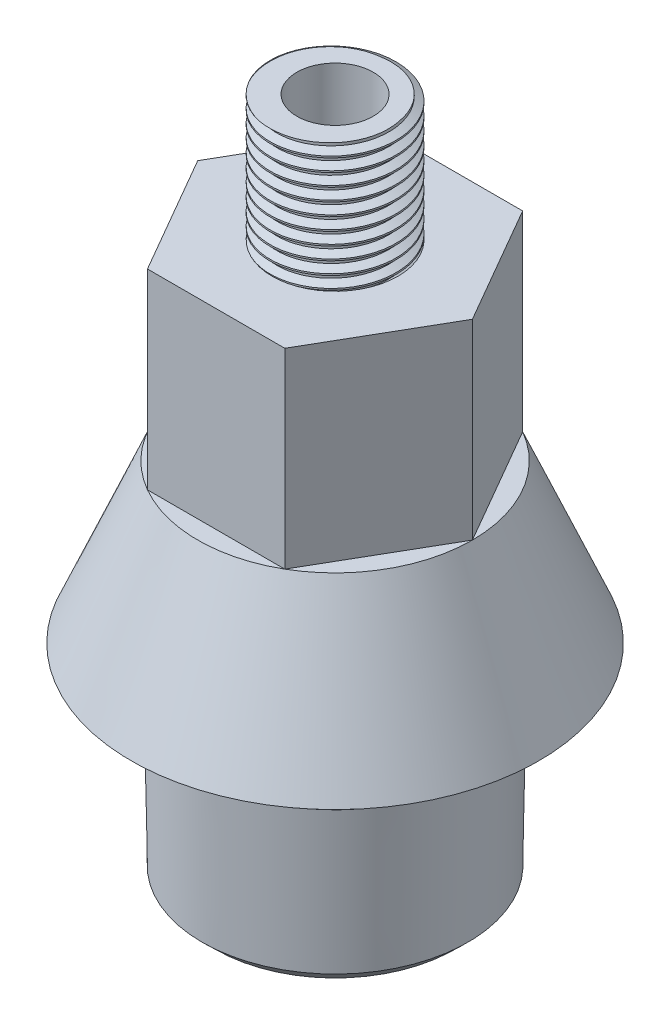
from build123d import *

# Parameters (mm, degrees)
BOSS_EXTRUDE1_DEPTH             = 19.0754
SKETCH2_R                       = 6.2738
BOSS_EXTRUDE2_DEPTH             = 12.5857
SKETCH3_R                       = 13.696826846
SKETCH4_R                       = 20.3327
SKETCH6_R                       = 13.5001
SKETCH8_R                       = 13.5001
BOSS_EXTRUDE3_DEPTH             = 15.6337
BOSS_EXTRUDE3_TAPER             = 1
CHAMFER1_SIZE                   = 1.27
CHAMFER1_SIZE_2                 = 1.292758643
THREAD1_PITCH                   = 1.27
CIRPATTERN1_COUNT               = 2
SKETCH13_R                      = 3.81
CUT_EXTRUDE1_DEPTH              = 47.3837
TAP_DRILL_FOR_5_8_11_TAP1_D     = 13.49248
TAP_DRILL_FOR_5_8_11_TAP1_DEPTH = 20.266950057
TAP_DRILL_FOR_5_8_11_TAP1_TIP   = 4.053549943


with BuildPart() as part:
    # Sketch1 → Boss-Extrude1 (new body)
    with BuildSketch(Plane(origin=(0, 0, 0), x_dir=(1, 0, 0), z_dir=(0, 1, 0))):
        Polygon((13.696826846, 0), (6.848413423, 11.8618), (-6.848413423, 11.8618), (-13.696826846, 0), (-6.848413423, -11.8618), (6.848413423, -11.8618), align=None)
    extrude(amount=BOSS_EXTRUDE1_DEPTH)

    # Sketch2 → Boss-Extrude2 (add)
    with BuildSketch(Plane(origin=(0, 19.0754, 0), x_dir=(1, 0, 0), z_dir=(0, 1, 0))):
        with Locations(Location((0, 0, 0), (0, 0, 270))):
            Circle(SKETCH2_R)
    extrude(amount=BOSS_EXTRUDE2_DEPTH)

    # Sketch3 → Loft1 section 0
    with BuildSketch(Plane.XZ):
        Circle(SKETCH3_R)
    # Sketch4 → Loft1 section 1
    with BuildSketch(Plane(origin=(0, -15.748, 0), x_dir=(-1, 0, 0), z_dir=(0, -1, 0))):
        Circle(SKETCH4_R)
    loft()

    # Sketch6 → section 0 of loft2
    with BuildSketch(Plane(origin=(0, -20.5994, 0), x_dir=(-1, 0, 0), z_dir=(0, -1, 0)), mode=Mode.PRIVATE) as loft2_s0:
        Circle(SKETCH6_R)
    # loft up to a face of the part (loft2)
    loft([loft2_s0.sketch, part.faces().sort_by_distance((0, -15.748, 0))[0]])

    # Sketch8 → Boss-Extrude3 (add)
    with BuildSketch(Plane.XZ.offset(20.5994)):
        Circle(SKETCH8_R)
    extrude(amount=BOSS_EXTRUDE3_DEPTH, taper=BOSS_EXTRUDE3_TAPER)

    # Chamfer1
    # the kernel refuses this chamfer: 1.292758643, 1.27 mm, written as the material it takes off along each edge
    with BuildSketch(Plane(origin=(0, -36.2331, 0), x_dir=(1, 0, 0), z_dir=(0, 0, 1))) as chamfer1_piece_1:
        Polygon((13.227212751 + CHAMFER1_SIZE * 0.0174524064373, CHAMFER1_SIZE * 0.999847695156), (13.227212751 - CHAMFER1_SIZE_2, 0), (13.227212751, 0), align=None)
    revolve(axis=Axis((0, -36.2331, 0), (0, 1, 0)), mode=Mode.SUBTRACT)

    # Thread1: the profile of Thread Profile1 profile screwed along a right-hand helix of 12.697402 turns, 8 arcs to a turn; built about Z, then put on its axis
    thread1_z = Axis((0, 0, 0), (0, 0, 1))
    thread1_corners = [(6.2741, 0, -0.000173205), (6.2741, 0, 1.111423202), (5.586392339, 0, 0.714374998), (5.586392339, 0, 0.396874998)]
    with BuildLine(mode=Mode.PRIVATE) as thread1_profile:
        Line(thread1_corners[0], thread1_corners[1])
        Line(thread1_corners[1], thread1_corners[2])
        Line(thread1_corners[2], thread1_corners[3])
        Line(thread1_corners[3], thread1_corners[0])
    thread1_cap = Face(thread1_profile.wire())
    thread1_turn_angles = [0, 22.5, 45, 67.5, 90, 112.5, 135, 157.5, 180, 202.5, 225, 247.5, 270, 292.5, 315, 337.5, 360]
    thread1_turn_weights = [1, 0.9238795325112867, 1, 0.9238795325112867, 1, 0.9238795325112867, 1, 0.9238795325112867, 1, 0.9238795325112867, 1, 0.9238795325112867, 1, 0.9238795325112867, 1, 0.9238795325112867, 1]
    thread1_turn_rails = [Edge.make_bspline([Vector(p[0], p[1], 0).rotate(thread1_z, thread1_turn_angles[k]) / thread1_turn_weights[k] + Vector(0, 0, p[2] + THREAD1_PITCH * thread1_turn_angles[k] / 360) for k in range(17)], [0, 0, 0, 1, 1, 2, 2, 3, 3, 4, 4, 5, 5, 6, 6, 7, 7, 8, 8, 8], 2, thread1_turn_weights) for p in thread1_corners]
    thread1_turn_sides = [Face.make_surface_from_curves(thread1_turn_rails[p[0]], thread1_turn_rails[p[1]]) for p in [(0, 1), (1, 2), (2, 3), (3, 0)]]
    thread1_last_angles = [4320, 4342.5, 4365, 4387.5, 4410, 4432.5, 4455, 4477.5, 4500, 4522.5, 4545, 4558.032283465, 4571.064566929]
    thread1_last_weights = [1, 0.9238795325112867, 1, 0.9238795325112867, 1, 0.9238795325112867, 1, 0.9238795325112867, 1, 0.9238795325112867, 1, 0.9742431608305986, 1]
    thread1_last_rails = [Edge.make_bspline([Vector(p[0], p[1], 0).rotate(thread1_z, thread1_last_angles[k]) / thread1_last_weights[k] + Vector(0, 0, p[2] + THREAD1_PITCH * thread1_last_angles[k] / 360) for k in range(13)], [0, 0, 0, 1, 1, 2, 2, 3, 3, 4, 4, 5, 5, 6, 6, 6], 2, thread1_last_weights) for p in thread1_corners]
    thread1_last_sides = [Face.make_surface_from_curves(thread1_last_rails[p[0]], thread1_last_rails[p[1]]) for p in [(0, 1), (1, 2), (2, 3), (3, 0)]]
    thread1 = Plane(origin=(0, 35.2011, 0), x_dir=(-1, 0, 0), z_dir=(0, -1, 0)) * Solid(Shell([*[p.moved(Location((0, 0, THREAD1_PITCH * i))) for i in range(12) for p in thread1_turn_sides], *thread1_last_sides, thread1_cap, thread1_cap.rotate(thread1_z, 4571.064566929).moved(Location((0, 0, THREAD1_PITCH * 4571.064566929 / 360)))]))
    add(thread1, mode=Mode.SUBTRACT)

    # Sketch12 → Cut-Revolve1 (revolve, cut)
    with BuildSketch(Plane.XY):
        Polygon((17.308986801, -17.894948777), (4.60290793, 0), (7.502358942, 2.058718005), (20.208437814, -15.836230772), align=None)
    cut_revolve1 = revolve(axis=Axis((17.308986801, -17.894948777, 0), (-0.578942071222714, 0.8153686762246598, 0)), mode=Mode.SUBTRACT)

    # CirPattern1: Cut-Revolve1 ×2 about axis
    cirpattern1_axis = Axis((0, -15.748, 0), (0, -1, 0))
    for i in range(1, CIRPATTERN1_COUNT):
        add(cut_revolve1.rotate(cirpattern1_axis, i * 360 / CIRPATTERN1_COUNT), mode=Mode.SUBTRACT)

    # Sketch13 → Cut-Extrude1 (cut)
    with BuildSketch(Plane(origin=(0, 31.6611, 0), x_dir=(1, 0, 0), z_dir=(0, 1, 0))):
        with Locations(Location((0, 0, 0), (0, 0, 270))):
            Circle(SKETCH13_R)
    extrude(amount=-CUT_EXTRUDE1_DEPTH, mode=Mode.SUBTRACT)

    # Tap Drill for 5/8-11 Tap1
    with Locations(Plane(origin=(0, -36.2331, 0), x_dir=(-1, 0, 0), z_dir=(0, -1, 0))):
        with Locations((0, 0)):
            Hole(TAP_DRILL_FOR_5_8_11_TAP1_D / 2, depth=TAP_DRILL_FOR_5_8_11_TAP1_DEPTH)
            with Locations((0, 0, -(TAP_DRILL_FOR_5_8_11_TAP1_DEPTH + TAP_DRILL_FOR_5_8_11_TAP1_TIP / 2))):  # 118° drill point
                Cone(0, TAP_DRILL_FOR_5_8_11_TAP1_D / 2, TAP_DRILL_FOR_5_8_11_TAP1_TIP, mode=Mode.SUBTRACT)


solid = part.part
